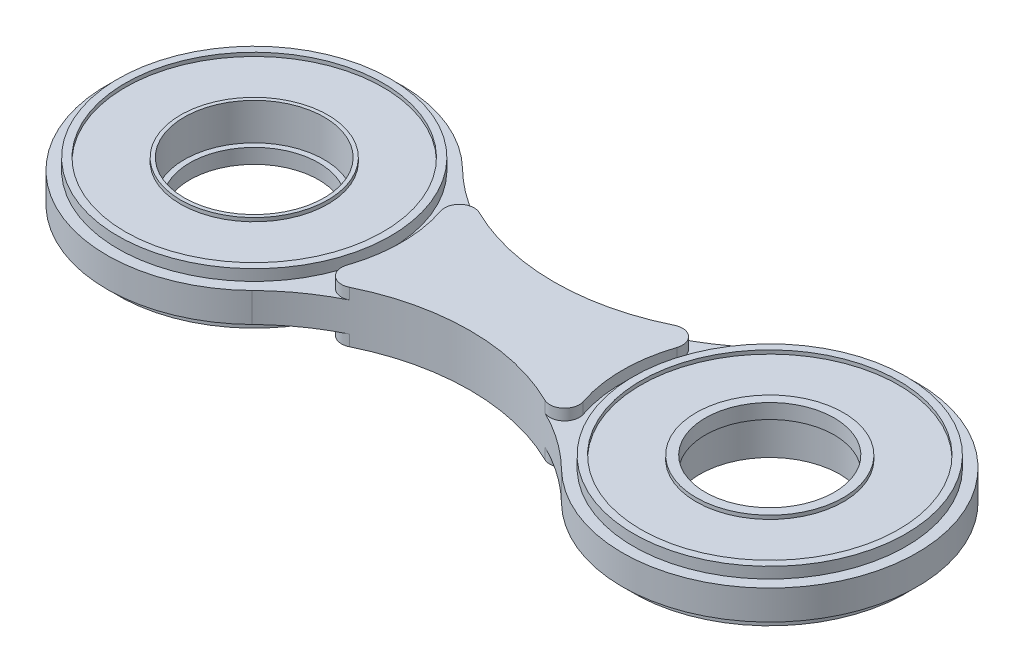
from build123d import *

# Parameters (mm, degrees)
BOSS_EXTRUDE1_DEPTH       = 3.5
SKETCH2_R                 = 9.5
CUT_EXTRUDE1_DEPTH        = 5
SKETCH3_R                 = 8.75
CUT_EXTRUDE2_DEPTH        = 59.736700622
SKETCH4_R                 = 9.5
CUT_EXTRUDE3_DEPTH        = 5
SKETCH5_R                 = 8.75
CUT_EXTRUDE4_DEPTH        = 59.736700622
SKETCH6_R                 = 17.5
SKETCH6_R_2               = 10
CUT_EXTRUDE5_DEPTH        = 0.5
SKETCH7_W                 = 1.5
SKETCH7_H                 = 1.5
FILLET1_START             = 2
FILLET1_DEPTH             = 2
MIRROR2_COPY_1_SKETCH_R   = 17.5
MIRROR2_COPY_1_SKETCH_R_2 = 10
MIRROR2_COPY_1_DEPTH      = 0.5
MIRROR2_COPY_2_SKETCH_W   = 1.5
MIRROR2_COPY_2_SKETCH_H   = 1.5
MIRROR2_START             = 2
MIRROR2_COPY_3_DEPTH      = 2


with BuildPart() as part:
    # Sketch1 → Boss-Extrude1 (new, symmetric)
    with BuildSketch(Plane(origin=(0, 0, 0), x_dir=(1, 0, 0), z_dir=(0, 1, 0))):
        with BuildLine():
            ThreePointArc((-21, 14.282856857), (-55, 0), (-21, -14.282856857))
            ThreePointArc((-21, -14.282856857), (0, -5.707142143), (21, -14.282856857))
            ThreePointArc((21, -14.282856857), (55, 0), (21, 14.282856857))
            ThreePointArc((21, 14.282856857), (0, 5.707142143), (-21, 14.282856857))
        make_face()
    extrude(amount=BOSS_EXTRUDE1_DEPTH, both=True)

    # Sketch2 → Cut-Extrude1 (cut)
    with BuildSketch(Plane(origin=(0, 3.5, 0), x_dir=(1, 0, 0), z_dir=(0, 1, 0))):
        with Locations(Location((-35, 0, 0), (0, 0, 270))):
            Circle(SKETCH2_R)
    extrude(amount=-CUT_EXTRUDE1_DEPTH, mode=Mode.SUBTRACT)

    # Sketch3 → Cut-Extrude2 (cut, through all)
    with BuildSketch(Plane(origin=(0, -1.5, 0), x_dir=(1, 0, 0), z_dir=(0, 1, 0))):
        with Locations(Location((-35, 0, 0), (0, 0, 270))):
            Circle(SKETCH3_R)
    extrude(amount=-CUT_EXTRUDE2_DEPTH, mode=Mode.SUBTRACT)

    # Sketch4 → Cut-Extrude3 (cut)
    with BuildSketch(Plane.XZ.offset(3.5)):
        with Locations(Location((35, 0, 0), (0, 0, 270))):
            Circle(SKETCH4_R)
    extrude(amount=-CUT_EXTRUDE3_DEPTH, mode=Mode.SUBTRACT)

    # Sketch5 → Cut-Extrude4 (cut, through all)
    with BuildSketch(Plane.XZ.offset(-1.5)):
        with Locations(Location((35, 0, 0), (0, 0, 270))):
            Circle(SKETCH5_R)
    extrude(amount=-CUT_EXTRUDE4_DEPTH, mode=Mode.SUBTRACT)

    # Sketch6 → Cut-Extrude5 (cut)
    with BuildSketch(Plane(origin=(0, 3.5, 0), x_dir=(1, 0, 0), z_dir=(0, 1, 0))):
        with Locations(Location((-35, 0, 0), (0, 0, 270))):
            Circle(SKETCH6_R)
        with Locations(Location((-35, 0, 0), (0, 0, 270))):
            Circle(SKETCH6_R_2, mode=Mode.SUBTRACT)
    cut_extrude5 = extrude(amount=-CUT_EXTRUDE5_DEPTH, mode=Mode.SUBTRACT)

    # Sketch7 → Cut-Revolve1 (revolve, cut)
    with BuildSketch(Plane.XY, mode=Mode.PRIVATE) as cut_revolve1_sk:
        with Locations((-54.25, 2.75)):
            Rectangle(SKETCH7_W, SKETCH7_H)
    cut_revolve1 = revolve(cut_revolve1_sk.sketch.rotate(Axis((-35, -6.63312042, 0), (0, 1, 0)), 270), axis=Axis((-35, -6.63312042, 0), (0, 1, 0)), mode=Mode.SUBTRACT)

    # Fillet1: read off the stored shape, not the designer's step
    # Fillet1 outline → Fillet1 (cut)
    with BuildSketch(Plane(origin=(0, 0, 0), x_dir=(1, 0, 0), z_dir=(0, 1, 0)).offset(FILLET1_START)):
        with BuildLine():
            ThreePointArc((-21, -14.282856857), (-17.348361604, -11.231963907), (-13.260269064, -8.796823223))
            ThreePointArc((-13.260269064, -8.796823223), (-15.460727643, -8.508452663), (-16.04026091, -6.366183602))
            ThreePointArc((-16.04026091, -6.366183602), (-18.051415131, -10.618167023), (-21, -14.282856857))
        make_face()
        with BuildLine():
            ThreePointArc((-21, 14.282856857), (-18.051415131, 10.618167023), (-16.04026091, 6.366183602))
            ThreePointArc((-16.04026091, 6.366183602), (-15.460727643, 8.508452663), (-13.260269064, 8.796823223))
            ThreePointArc((-13.260269064, 8.796823223), (-17.348361604, 11.231963907), (-21, 14.282856857))
        make_face()
    fillet1 = extrude(amount=FILLET1_DEPTH, mode=Mode.SUBTRACT)

    # Mirror1: Cut-Extrude5, Cut-Revolve1, Fillet1 across plane
    add(cut_extrude5.mirror(Plane.ZX), mode=Mode.SUBTRACT)
    add(cut_revolve1.mirror(Plane.ZX), mode=Mode.SUBTRACT)
    add(fillet1.mirror(Plane.ZX), mode=Mode.SUBTRACT)

    # Mirror2: Cut-Extrude5, Cut-Revolve1, Fillet1 across plane
    add(cut_extrude5.mirror(Plane(origin=(0, 0, 0), x_dir=(0, 0, 1), z_dir=(1, 0, 0))), mode=Mode.SUBTRACT)
    add(cut_revolve1.mirror(Plane(origin=(0, 0, 0), x_dir=(0, 0, 1), z_dir=(1, 0, 0))), mode=Mode.SUBTRACT)
    add(fillet1.mirror(Plane(origin=(0, 0, 0), x_dir=(0, 0, 1), z_dir=(1, 0, 0))), mode=Mode.SUBTRACT)

    # Mirror2 copy 1 sketch → Mirror2 copy 1 (cut)
    with BuildSketch(Plane(origin=(0, -3.5, 0), x_dir=(-1, 0, 0), z_dir=(0, -1, 0))):
        with Locations(Location((-35, 0, 0), (0, 0, 270))):
            Circle(MIRROR2_COPY_1_SKETCH_R)
        with Locations(Location((-35, 0, 0), (0, 0, 270))):
            Circle(MIRROR2_COPY_1_SKETCH_R_2, mode=Mode.SUBTRACT)
    extrude(amount=-MIRROR2_COPY_1_DEPTH, mode=Mode.SUBTRACT)

    # Mirror2 copy 2 sketch → Mirror2 copy 2 (revolve, cut)
    with BuildSketch(Plane(origin=(0, 0, 0), x_dir=(-1, 0, 0), z_dir=(0, 0, 1))):
        with Locations((-54.25, 2.75)):
            Rectangle(MIRROR2_COPY_2_SKETCH_W, MIRROR2_COPY_2_SKETCH_H)
    revolve(axis=Axis((35, 6.63312042, 0), (0, -1, 0)), mode=Mode.SUBTRACT)

    # Mirror2 copy 3 sketch → Mirror2 copy 3 (cut)
    with BuildSketch(Plane(origin=(0, 0, 0), x_dir=(-1, 0, 0), z_dir=(0, -1, 0)).offset(MIRROR2_START)):
        with BuildLine():
            ThreePointArc((-21, -14.282856857), (-17.348361604, -11.231963907), (-13.260269064, -8.796823223))
            ThreePointArc((-13.260269064, -8.796823223), (-15.460727643, -8.508452663), (-16.04026091, -6.366183602))
            ThreePointArc((-16.04026091, -6.366183602), (-18.051415131, -10.618167023), (-21, -14.282856857))
        make_face()
        with BuildLine():
            ThreePointArc((-21, 14.282856857), (-18.051415131, 10.618167023), (-16.04026091, 6.366183602))
            ThreePointArc((-16.04026091, 6.366183602), (-15.460727643, 8.508452663), (-13.260269064, 8.796823223))
            ThreePointArc((-13.260269064, 8.796823223), (-17.348361604, 11.231963907), (-21, 14.282856857))
        make_face()
    extrude(amount=MIRROR2_COPY_3_DEPTH, mode=Mode.SUBTRACT)


solid = part.part
